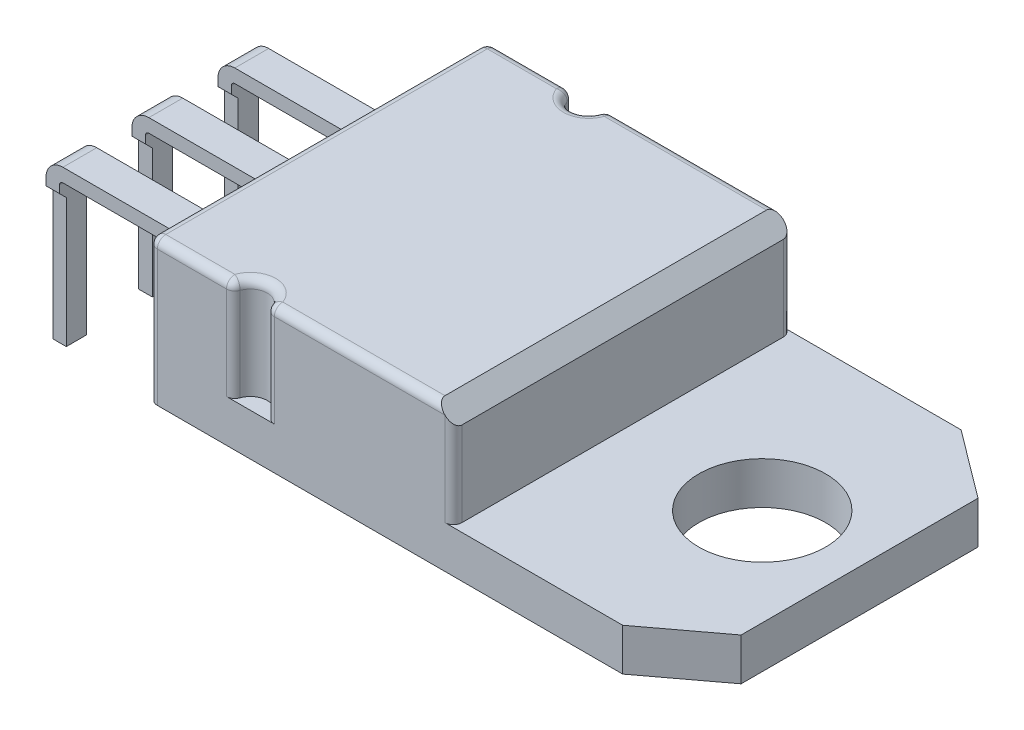
from build123d import *

# Parameters (mm, degrees)
SKETCH_1_R               = 1.875
EXTRUDE_1_DEPTH          = 1.25
EXTRUDE_2_DEPTH          = 3
FILLET_1_R               = 0.25
CHAMFER_1_SIZE           = 0.5
SKETCH_3_W               = 0.999690432
SKETCH_3_H               = 0.4
CUT_EXTRUDE_1_REACH      = 25.645
PATTERN_LINEAR_1_COUNT   = 2
PATTERN_LINEAR_1_PITCH   = 2.54
MIRROR_1_COPY_1_SKETCH_W = 0.999690432
MIRROR_1_COPY_1_SKETCH_H = 0.4
MIRROR_1_COPY_2_REACH    = 25.645


with BuildPart() as part:
    # 草图1 → 凸台-拉伸1 (new body)
    with BuildSketch(Plane(origin=(0, 0, 0), x_dir=(1, 0, 0), z_dir=(0, 1, 0))):
        Polygon((0, 0), (14, 0), (16, 1.5), (16, 8.5), (14, 10), (0, 10), align=None)
        with Locations(Location((13.125, 5, 0), (0, 0, 270))):
            Circle(SKETCH_1_R, mode=Mode.SUBTRACT)
    extrude(amount=EXTRUDE_1_DEPTH)

    # 草图2 → 凸台-拉伸2 (add)
    with BuildSketch(Plane(origin=(0, 1.25, 0), x_dir=(1, 0, 0), z_dir=(0, 1, 0))):
        with BuildLine():
            Line((0, 10), (2.5, 10))
            ThreePointArc((2.5, 10), (3, 9.5), (3.5, 10))
            Line((3.5, 10), (9, 10))
            Line((9, 10), (9, 0))
            Line((9, 0), (3.5, 0))
            ThreePointArc((3.5, 0), (3, 0.5), (2.5, 0))
            Line((2.5, 0), (0, 0))
            Line((0, 0), (0, 10))
        make_face()
    extrude(amount=EXTRUDE_2_DEPTH)

    # 圆角1
    fillet_1_edges = [part.edges().sort_by_distance(p)[0] for p in [
        (0, 2.125, -10),
        (2.5, 2.75, -10),
        (3.5, 2.75, -10),
        (6.25, 4.25, -10),
        (3, 4.25, -9.5),
        (1.25, 4.25, -10),
        (0, 4.25, -5),
        (0, 2.125, 0),
        (3.5, 2.75, 0),
        (2.5, 2.75, 0),
        (1.25, 4.25, 0),
        (3, 4.25, -0.5),
        (6.25, 4.25, 0),
        (9, 2.75, -10),
        (9, 2.75, 0),
    ]]
    fillet(fillet_1_edges, radius=FILLET_1_R)

    # 倒角1
    # the kernel refuses this chamfer: 0.5 mm, written as the material it takes off along each edge
    with BuildSketch(Plane(origin=(9, 4.25, -11.035841494), x_dir=(-0.9996219169112968, 0.027495876610585647, 0), z_dir=(0, 0, 1))) as chamfer_1_piece_1:
        Polygon((CHAMFER_1_SIZE * 0.999621916911, CHAMFER_1_SIZE * 0.0274958766106), (-CHAMFER_1_SIZE * 0.0274958766106, CHAMFER_1_SIZE * 0.999621916911), (0, 0), align=None)
    extrude(amount=12.071682988, mode=Mode.SUBTRACT)

    # 扫描1: sweep along a path in 草图4
    with BuildLine(Plane(origin=(0, 0, -5), x_dir=(-1, 0, 0), z_dir=(0, 0, -1))) as sweep_1_path:
        Line((0, 2.74), (4.5, 2.74))
        ThreePointArc((4.5, 2.74), (4.853553391, 2.593553391), (5, 2.24))
        Line((5, 2.24), (5, -2))
    # 草图3 → 扫描1 (sweep)
    with BuildSketch(Plane.ZY):
        with Locations((-5, 2.54)):
            Rectangle(SKETCH_3_W, SKETCH_3_H)
    sweep_1 = sweep(path=sweep_1_path.line)

    # 草图5 → 切除-拉伸1 (cut, up to next)
    with BuildSketch(Plane.ZY.offset(5), mode=Mode.PRIVATE) as cut_extrude_1_sk1:
        Polygon((-4.7, 1.814659855), (-4.7, -2), (-4.500154784, -2), (-4.500154784, 2.014505072), align=None)
    cut_extrude_1_tool1 = extrude(cut_extrude_1_sk1.sketch, amount=-CUT_EXTRUDE_1_REACH, mode=Mode.PRIVATE) & part.part
    # 草图5 → 切除-拉伸1 (cut, up to next)
    with BuildSketch(Plane.ZY.offset(5), mode=Mode.PRIVATE) as cut_extrude_1_sk2:
        Polygon((-5.3, 1.814659855), (-5.3, -2), (-5.499845216, -2), (-5.499845216, 2.014505072), align=None)
    cut_extrude_1_tool2 = extrude(cut_extrude_1_sk2.sketch, amount=-CUT_EXTRUDE_1_REACH, mode=Mode.PRIVATE) & part.part
    cut_extrude_1_1 = cut_extrude_1_tool1.solids().sort_by_distance((-5, -0.042284, -4.599227))[0]
    add(cut_extrude_1_1, mode=Mode.SUBTRACT)
    cut_extrude_1_2 = cut_extrude_1_tool2.solids().sort_by_distance((-5, -0.042284, -5.400773))[0]
    add(cut_extrude_1_2, mode=Mode.SUBTRACT)
    cut_extrude_1 = cut_extrude_1_1 + cut_extrude_1_2  # 切除-拉伸1 as one shape, for the pattern or mirror that repeats it

    # 阵列(线性)1: 扫描1, 切除-拉伸1 ×2
    with Locations(*[(0, 0, i * PATTERN_LINEAR_1_PITCH) for i in range(1, PATTERN_LINEAR_1_COUNT)]):
        add(sweep_1)
        add(cut_extrude_1, mode=Mode.SUBTRACT)

    # 镜向1: 扫描1, 切除-拉伸1 across plane
    add(sweep_1.mirror(Plane(origin=(0, 0, -5), x_dir=(1, 0, 0), z_dir=(0, 0, -1))))
    add(cut_extrude_1.mirror(Plane(origin=(0, 0, -5), x_dir=(1, 0, 0), z_dir=(0, 0, -1))), mode=Mode.SUBTRACT)

    # 镜向1 copy 1: sweep along a path in 镜向1 copy 1 path
    with BuildLine(Plane(origin=(0, 0, -7.54), x_dir=(-1, 0, 0), z_dir=(0, 0, 1))) as mirror_1_copy_1_path:
        Line((0, -2.74), (4.5, -2.74))
        ThreePointArc((4.5, -2.74), (4.853553391, -2.593553391), (5, -2.24))
        Line((5, -2.24), (5, 2))
    # 镜向1 copy 1 sketch → 镜向1 copy 1 (sweep)
    with BuildSketch(Plane(origin=(0, 0, -12.54), x_dir=(0, 0, -1), z_dir=(-1, 0, 0))):
        with Locations((-5, -2.54)):
            Rectangle(MIRROR_1_COPY_1_SKETCH_W, MIRROR_1_COPY_1_SKETCH_H)
    sweep(path=mirror_1_copy_1_path.line)

    # 镜向1 copy 2 sketch → 镜向1 copy 2 (cut, up to next)
    with BuildSketch(Plane(origin=(-5, 0, -12.54), x_dir=(0, 0, -1), z_dir=(-1, 0, 0)), mode=Mode.PRIVATE) as mirror_1_copy_2_sk1:
        Polygon((-4.7, -1.814659855), (-4.7, 2), (-4.500154784, 2), (-4.500154784, -2.014505072), align=None)
    mirror_1_copy_2_tool1 = extrude(mirror_1_copy_2_sk1.sketch, amount=-MIRROR_1_COPY_2_REACH, mode=Mode.PRIVATE) & part.part
    # 镜向1 copy 2 sketch → 镜向1 copy 2 (cut, up to next)
    with BuildSketch(Plane(origin=(-5, 0, -12.54), x_dir=(0, 0, -1), z_dir=(-1, 0, 0)), mode=Mode.PRIVATE) as mirror_1_copy_2_sk2:
        Polygon((-5.3, -1.814659855), (-5.3, 2), (-5.499845216, 2), (-5.499845216, -2.014505072), align=None)
    mirror_1_copy_2_tool2 = extrude(mirror_1_copy_2_sk2.sketch, amount=-MIRROR_1_COPY_2_REACH, mode=Mode.PRIVATE) & part.part
    add(mirror_1_copy_2_tool1.solids().sort_by_distance((-5, -0.042284, -7.940773))[0], mode=Mode.SUBTRACT)
    add(mirror_1_copy_2_tool2.solids().sort_by_distance((-5, -0.042284, -7.139227))[0], mode=Mode.SUBTRACT)


solid = part.part
